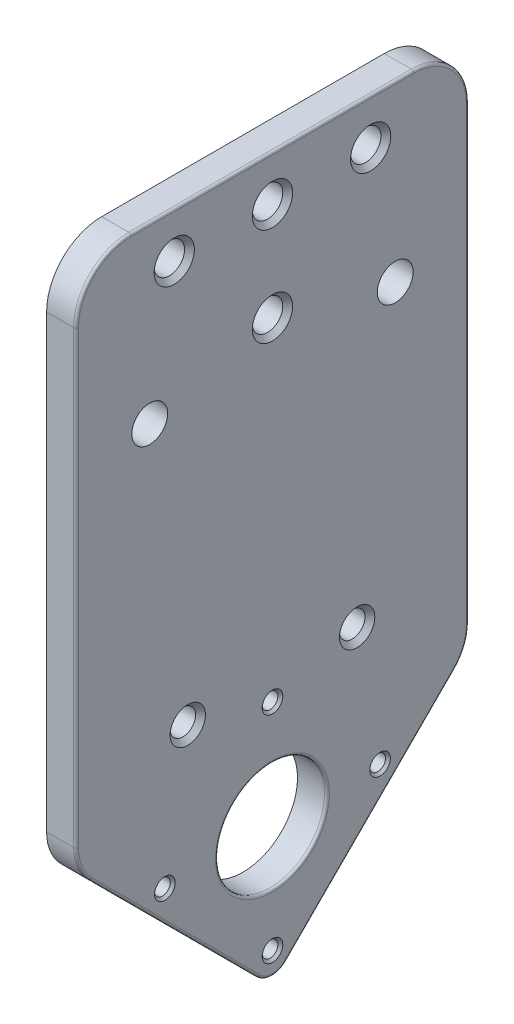
from build123d import *

# Parameters (mm, degrees)
SKETCH_2_R      = 1.6
SKETCH_2_R_2    = 2.6
SKETCH_2_R_3    = 11.1
SKETCH_2_R_4    = 3.655
SKETCH_2_R_5    = 3.1
EXTRUDE_1_DEPTH = 6
CHAMFER_1_SIZE  = 1
CHAMFER_2_SIZE  = 0.5
FILLET_1_R      = 0.5


with BuildPart() as part:
    # Эскиз2 → Бобышка-Вытянуть1 (new body)
    with BuildSketch(Plane(origin=(0, 0, 0), x_dir=(0, 0, -1), z_dir=(1, 0, 0))):
        with BuildLine():
            Line((-28.783294421, 72.542236653), (28.783294421, 72.542236653))
            ThreePointArc((28.783294421, 72.542236653), (36.714702999, 69.256939651), (40, 61.325531074))
            Line((40, 61.325531074), (40, -30.391408151))
            ThreePointArc((40, -30.391408151), (39.238795325, -34.218242474), (37.071067812, -37.462475962))
            Line((37.071067812, -37.462475962), (2.828427125, -71.70511665))
            ThreePointArc((2.828427125, -71.70511665), (0, -72.876689525), (-2.828427125, -71.70511665))
            Line((-2.828427125, -71.70511665), (-37.071067812, -37.462475962))
            ThreePointArc((-37.071067812, -37.462475962), (-39.238795325, -34.218242474), (-40, -30.391408151))
            Line((-40, -30.391408151), (-40, 61.325531074))
            ThreePointArc((-40, 61.325531074), (-36.714702999, 69.256939651), (-28.783294421, 72.542236653))
        make_face()
        with Locations((-21.913410217, -46.3871)):
            Circle(SKETCH_2_R, mode=Mode.SUBTRACT)
        with Locations((17.25, -19.8871)):
            Circle(SKETCH_2_R_2, mode=Mode.SUBTRACT)
        with Locations((-17.25, -19.8871)):
            Circle(SKETCH_2_R_2, mode=Mode.SUBTRACT)
        with Locations((0.0069, -46.3871)):
            Circle(SKETCH_2_R_3, mode=Mode.SUBTRACT)
        with Locations((-25, 37.1129)):
            Circle(SKETCH_2_R_4, mode=Mode.SUBTRACT)
        with Locations((-20, 63.3206)):
            Circle(SKETCH_2_R_5, mode=Mode.SUBTRACT)
        with Locations((0, 63.3206)):
            Circle(SKETCH_2_R_5, mode=Mode.SUBTRACT)
        with Locations((0, 43.3206)):
            Circle(SKETCH_2_R_5, mode=Mode.SUBTRACT)
        with Locations((20, 63.3206)):
            Circle(SKETCH_2_R_5, mode=Mode.SUBTRACT)
        with Locations((25, 37.1129)):
            Circle(SKETCH_2_R_4, mode=Mode.SUBTRACT)
        with Locations((0.0069, -24.466789783)):
            Circle(SKETCH_2_R, mode=Mode.SUBTRACT)
        with Locations((21.927210217, -46.3871)):
            Circle(SKETCH_2_R, mode=Mode.SUBTRACT)
        with Locations((0.0069, -68.307410217)):
            Circle(SKETCH_2_R, mode=Mode.SUBTRACT)
    extrude(amount=EXTRUDE_1_DEPTH)

    # Фаска1
    chamfer_1_edges = [part.edges().sort_by_distance(p)[0] for p in [
        (6, 63.3206, -16.9),
        (6, 63.3206, 23.1),
        (6, 63.3206, 3.1),
        (6, 43.3206, 3.1),
        (6, -19.8871, 19.85),
        (6, -19.8871, -14.65),
    ]]
    chamfer(chamfer_1_edges, length=CHAMFER_1_SIZE)

    # Фаска2
    chamfer_2_edges = [part.edges().sort_by_distance(p)[0] for p in [
        (6, -68.307410217, 1.5931),
        (6, -46.3871, -20.327210217),
        (6, -46.3871, 23.513410217),
        (6, -24.466789783, 1.5931),
    ]]
    chamfer(chamfer_2_edges, length=CHAMFER_2_SIZE)

    # Скругление1
    fillet_1_edges = [part.edges().sort_by_distance(p)[0] for p in [
        (6, 69.256939651, -36.714702999),
        (6, 15.467061462, -40),
        (6, -34.218242474, -39.238795325),
        (6, -54.583796306, -19.949747468),
        (6, -72.876689525, 0),
        (6, -54.583796306, 19.949747468),
        (6, -34.218242474, 39.238795325),
        (6, 15.467061462, 40),
        (6, 69.256939651, 36.714702999),
        (6, 72.542236653, 0),
        (6, -46.3871, 11.0931),
    ]]
    fillet(fillet_1_edges, radius=FILLET_1_R)


solid = part.part
